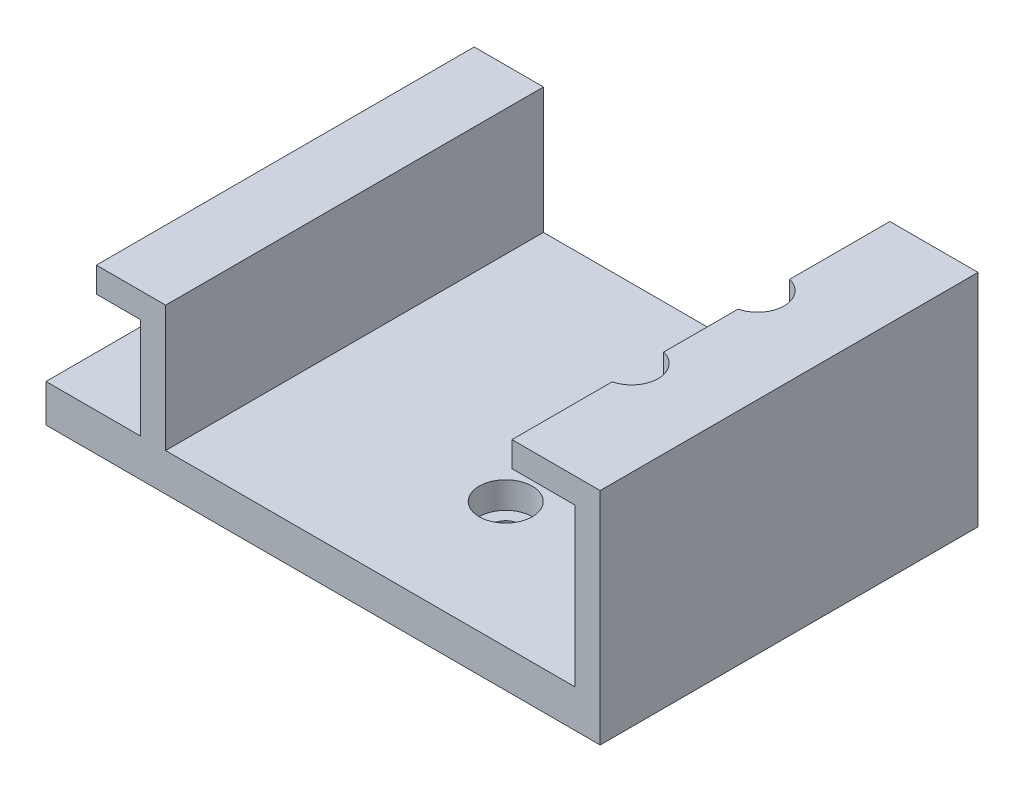
from build123d import *

# Parameters (mm, degrees)
BOSS_EXTRUDE1_DEPTH     = 60
SKETCH2_R               = 2.2
CUT_EXTRUDE1_DEPTH      = 10
CUT_EXTRUDE2_DEPTH      = 40
CUT_EXTRUDE2_DEPTH_BACK = 4.2
SKETCH3_R               = 4.215


with BuildPart() as part:
    # Sketch1 → Boss-Extrude1 (new body)
    with BuildSketch(Plane.XY):
        Polygon((-14, 0), (0, 0), (0, -35), (-88, -35), (-88, -29), (-73, -29), (-73, -13), (-80, -13), (-80, -9), (-69, -9), (-69, -29), (-4, -29), (-4, -4), (-14, -4), align=None)
    extrude(amount=BOSS_EXTRUDE1_DEPTH)

    # Sketch2 → Cut-Extrude1 (cut)
    with BuildSketch(Plane(origin=(0, -29, 0), x_dir=(1, 0, 0), z_dir=(0, 1, 0))):
        with Locations((-15, -40)):
            Circle(SKETCH2_R)
        with Locations((-15, -20)):
            Circle(SKETCH2_R)
        with Locations((-35, -20)):
            Circle(SKETCH2_R)
        with Locations((-35, -40)):
            Circle(SKETCH2_R)
    extrude(amount=-CUT_EXTRUDE1_DEPTH, mode=Mode.SUBTRACT)

    # Sketch3 → Cut-Extrude2 (cut, two sides: drawn at the far end of the back side and taken through both)
    with BuildSketch(Plane(origin=(0, -29, 0), x_dir=(1, 0, 0), z_dir=(0, 1, 0)).offset(-CUT_EXTRUDE2_DEPTH_BACK)):
        with Locations((-35, -20)):
            Circle(SKETCH3_R)
        with Locations((-15, -20)):
            Circle(SKETCH3_R)
        with Locations((-15, -40)):
            Circle(SKETCH3_R)
        with Locations((-35, -40)):
            Circle(SKETCH3_R)
    extrude(amount=CUT_EXTRUDE2_DEPTH + CUT_EXTRUDE2_DEPTH_BACK, mode=Mode.SUBTRACT)


solid = part.part
